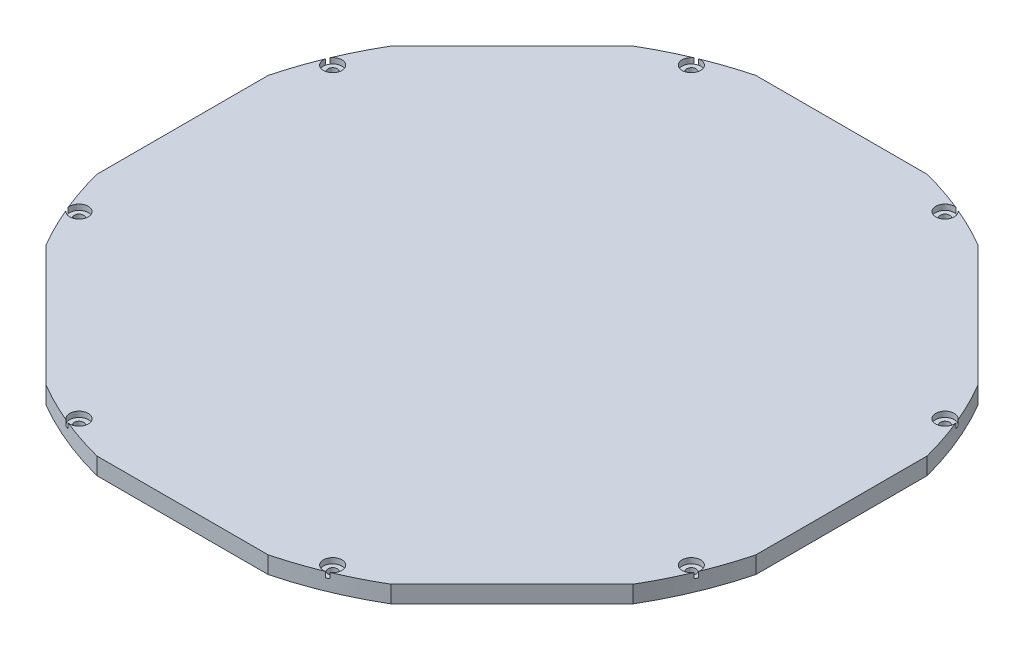
from build123d import *

# Parameters (mm, degrees)
BOSS_EXTRUDE1_DEPTH       = 6.35
SKETCH2_R                 = 119.0625
SKETCH2_R_2               = 115.2525
CUT_EXTRUDE1_DEPTH        = 2.667
ADVANCEDHOLE1_START       = 4.318
ADVANCEDHOLE1_DEPTH       = 2.032
ADVANCEDHOLE1_2_OUTLINE_R = 1.7272
ADVANCEDHOLE1_2_DEPTH     = 4.318
CIRPATTERN1_COUNT         = 8


# Read off the part's stored shape, not the designer's step: AdvancedHole1
with BuildPart() as part:
    # Sketch1 → Boss-Extrude1 (new body)
    with BuildSketch(Plane(origin=(0, 0, 0), x_dir=(1, 0, 0), z_dir=(0, 1, 0))):
        with BuildLine():
            ThreePointArc((-31.793446259, 122.3), (-48.357791931, 116.746037126), (-63.997797892, 108.960520786))
            Line((-63.997797892, 108.960520786), (-108.960520786, 63.997797892))
            ThreePointArc((-108.960520786, 63.997797892), (-116.746037126, 48.357791931), (-122.3, 31.793446259))
            Line((-122.3, 31.793446259), (-122.3, -31.793446259))
            ThreePointArc((-122.3, -31.793446259), (-116.746037126, -48.357791931), (-108.960520786, -63.997797892))
            Line((-108.960520786, -63.997797892), (-63.997797892, -108.960520786))
            ThreePointArc((-63.997797892, -108.960520786), (-48.357791931, -116.746037126), (-31.793446259, -122.3))
            Line((-31.793446259, -122.3), (31.793446259, -122.3))
            ThreePointArc((31.793446259, -122.3), (48.357791931, -116.746037126), (63.997797892, -108.960520786))
            Line((63.997797892, -108.960520786), (108.960520786, -63.997797892))
            ThreePointArc((108.960520786, -63.997797892), (116.746037126, -48.357791931), (122.3, -31.793446259))
            Line((122.3, -31.793446259), (122.3, 31.793446259))
            ThreePointArc((122.3, 31.793446259), (116.746037126, 48.357791931), (108.960520786, 63.997797892))
            Line((108.960520786, 63.997797892), (63.997797892, 108.960520786))
            ThreePointArc((63.997797892, 108.960520786), (48.357791931, 116.746037126), (31.793446259, 122.3))
            Line((31.793446259, 122.3), (-31.793446259, 122.3))
        make_face()
    extrude(amount=BOSS_EXTRUDE1_DEPTH)

    # Sketch2 → Cut-Extrude1 (cut)
    with BuildSketch(Plane.XZ):
        with Locations(Location((0, 0, 0), (0, 0, 270))):
            Circle(SKETCH2_R)
        with Locations(Location((0, 0, 0), (0, 0, 270))):
            Circle(SKETCH2_R_2, mode=Mode.SUBTRACT)
    extrude(amount=-CUT_EXTRUDE1_DEPTH, mode=Mode.SUBTRACT)

    # AdvancedHole1 outline → AdvancedHole1 (cut)
    with BuildSketch(Plane(origin=(0, 0, 0), x_dir=(1, 0, 0), z_dir=(0, 1, 0)).offset(ADVANCEDHOLE1_START)):
        with BuildLine():
            ThreePointArc((-47.742027192, 116.999196855), (-48.357791931, 116.746037126), (-48.972214314, 116.489636665))
            ThreePointArc((-48.972214314, 116.489636665), (-45.757649346, 110.468737644), (-47.742027192, 116.999196855))
        make_face()
    advancedhole1 = extrude(amount=ADVANCEDHOLE1_DEPTH, mode=Mode.SUBTRACT)

    # AdvancedHole1 2 outline → AdvancedHole1 2 (cut)
    with BuildSketch(Plane(origin=(0, 0, 0), x_dir=(1, 0, 0), z_dir=(0, 1, 0))):
        with Locations((-47.069870839, 113.636720559)):
            Circle(ADVANCEDHOLE1_2_OUTLINE_R)
    advancedhole1_2 = extrude(amount=ADVANCEDHOLE1_2_DEPTH, mode=Mode.SUBTRACT)

    # CirPattern1: AdvancedHole1, AdvancedHole1 2 ×8 about axis
    cirpattern1_axis = Axis((0, 0, 0), (0, 1, 0))
    add([advancedhole1.rotate(cirpattern1_axis, i * 360 / CIRPATTERN1_COUNT) for i in range(1, CIRPATTERN1_COUNT)], mode=Mode.SUBTRACT)
    add([advancedhole1_2.rotate(cirpattern1_axis, i * 360 / CIRPATTERN1_COUNT) for i in range(1, CIRPATTERN1_COUNT)], mode=Mode.SUBTRACT)


solid = part.part
